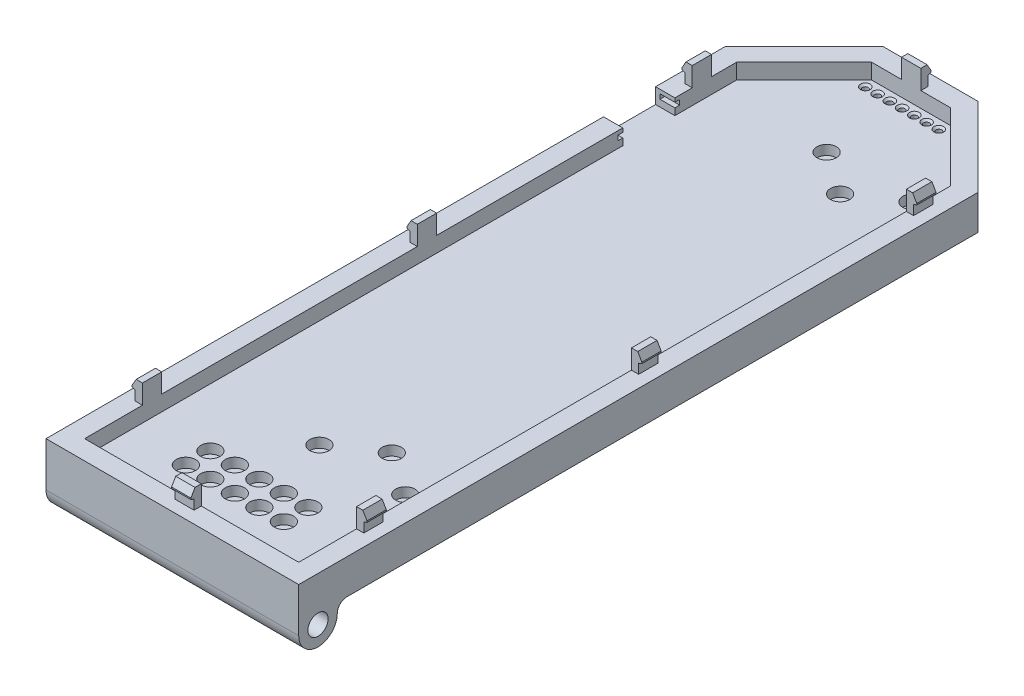
from build123d import *

# Parameters (mm, degrees)
BOSS_EXTRUDE1_DEPTH  = 3.6
CUT_EXTRUDE1_START   = 3.6
CUT_EXTRUDE1_DEPTH   = 1.6
SKETCH3_R            = 0.3
CUT_EXTRUDE2_DEPTH   = 78.737828629
BOSS_EXTRUDE3_DEPTH  = 3
BOSS_EXTRUDE3_TAPER  = 10
SKETCH3_2_R          = 0.3
CUT_EXTRUDE3_DEPTH   = 78.872780874
LPATTERN5_COUNT      = 7
LPATTERN5_PITCH      = 1.27
CHAMFER2_SIZE        = 0.2
FILLET2_R            = 1
BOSS_EXTRUDE4_DEPTH  = 26.2
SKETCH7_R            = 1.05
CUT_EXTRUDE4_DEPTH   = 82.036781772
SKETCH8_W            = 4
SKETCH8_H            = 5.4
CUT_EXTRUDE5_DEPTH   = 1.6
SKETCH9_R            = 1
CUT_EXTRUDE7_DEPTH   = 1
LPATTERN6_COUNT      = 5
LPATTERN6_PITCH      = 2.54
LPATTERN6_COUNT_DIR2 = 2
LPATTERN6_PITCH_DIR2 = 2.54
SKETCH10_R           = 1
CUT_EXTRUDE8_DEPTH   = 1
BOSS_EXTRUDE5_DEPTH  = 1
LPATTERN7_COUNT      = 3
LPATTERN7_PITCH      = 28.5
MIRROR1_COPY_1_DEPTH = 1
MIRROR1_COPY_2_DEPTH = 1
BOSS_EXTRUDE6_DEPTH  = 1
SKETCH14_W           = 6.4
SKETCH14_H           = 0.5
CUT_EXTRUDE9_DEPTH   = 1.55
FILLET3_R            = 1
SKETCH15_R           = 2.794
CUT_EXTRUDE10_DEPTH  = 0.25


with BuildPart() as part:
    # Sketch2 → Boss-Extrude1 (new body)
    with BuildSketch(Plane(origin=(0, 0, 0), x_dir=(1, 0, 0), z_dir=(0, 1, 0))):
        Polygon((0, -2), (-13.1, -2), (-13.1, 68.428427125), (-4.928427125, 76.6), (0, 76.6), (4.928427125, 76.6), (13.1, 68.428427125), (13.1, -2), align=None)
    extrude(amount=BOSS_EXTRUDE1_DEPTH)

    # Sketch1 → Cut-Extrude1 (cut)
    with BuildSketch(Plane(origin=(0, 0, 0), x_dir=(1, 0, 0), z_dir=(0, 1, 0)).offset(CUT_EXTRUDE1_START)):
        Polygon((0, 0), (-11.1, 0), (-11.1, 67.6), (-4.1, 74.6), (0, 74.6), (4.1, 74.6), (11.1, 67.6), (11.1, 0), align=None)
    extrude(amount=-CUT_EXTRUDE1_DEPTH, mode=Mode.SUBTRACT)

    # Sketch3 → Cut-Extrude2 (cut, through all)
    with BuildSketch(Plane(origin=(0, 2, 0), x_dir=(1, 0, 0), z_dir=(0, 1, 0))):
        with Locations(Location((-3.81, 73.66, 0), (0, 0, 270))):
            Circle(SKETCH3_R)
    extrude(amount=-CUT_EXTRUDE2_DEPTH, mode=Mode.SUBTRACT)

    # Sketch5 → Boss-Extrude3 (add)
    with BuildSketch(Plane(origin=(0, 0, 0), x_dir=(-1, 0, 0), z_dir=(0, -1, 0))):
        with BuildLine():
            ThreePointArc((3.81, 72.41), (5.06, 73.66), (3.81, 74.91))
            Line((3.81, 74.91), (-3.782252271, 74.91))
            ThreePointArc((-3.782252271, 74.91), (-5.032252271, 73.66), (-3.782252271, 72.41))
            Line((-3.782252271, 72.41), (3.81, 72.41))
        make_face()
    extrude(amount=BOSS_EXTRUDE3_DEPTH, taper=BOSS_EXTRUDE3_TAPER)

    # Sketch3<2> → Cut-Extrude3 (cut, through all)
    with BuildSketch(Plane(origin=(0, 2, 0), x_dir=(1, 0, 0), z_dir=(0, 1, 0))):
        with Locations(Location((-3.81, 73.66, 0), (0, 0, 270))):
            Circle(SKETCH3_2_R)
    cut_extrude3 = extrude(amount=-CUT_EXTRUDE3_DEPTH, mode=Mode.SUBTRACT)

    # LPattern5: Cut-Extrude3 ×7
    with Locations(*[(i * LPATTERN5_PITCH, 0, 0) for i in range(1, LPATTERN5_COUNT)]):
        add(cut_extrude3, mode=Mode.SUBTRACT)

    # Chamfer2
    chamfer2_edges = [part.edges().sort_by_distance(p)[0] for p in [
        (-3.81, 2, -73.96),
        (-2.54, 2, -73.96),
        (-1.27, 2, -73.96),
        (0, 2, -73.96),
        (1.27, 2, -73.96),
        (2.54, 2, -73.96),
        (3.81, 2, -73.96),
    ]]
    chamfer(chamfer2_edges, length=CHAMFER2_SIZE)

    # Fillet2
    fillet2_edges = [part.edges().sort_by_distance(p)[0] for p in [
        (-5.06, 0, -73.66),
        (-0.013873865, 0, -74.91),
        (5.032252271, 0, -73.66),
        (-0.013873865, 0, -72.41),
    ]]
    fillet(fillet2_edges, radius=FILLET2_R)

    # Sketch6 → Boss-Extrude4 (add)
    with BuildSketch(Plane.ZY.offset(13.1)):
        with BuildLine():
            Line((2, -1), (2, 0))
            Line((2, 0), (-2, 0))
            Line((-2, 0), (-2, -1))
            ThreePointArc((-2, -1), (0, -3), (2, -1))
        make_face()
    extrude(amount=-BOSS_EXTRUDE4_DEPTH)

    # Sketch7 → Cut-Extrude4 (cut, through all)
    with BuildSketch(Plane.ZY.offset(13.1)):
        with Locations((0, -1)):
            Circle(SKETCH7_R)
    extrude(amount=-CUT_EXTRUDE4_DEPTH, mode=Mode.SUBTRACT)

    # Sketch8 → Cut-Extrude5 (cut)
    with BuildSketch(Plane(origin=(0, 3.6, 0), x_dir=(1, 0, 0), z_dir=(0, 1, 0))):
        with Locations((-11.1, 58.5)):
            Rectangle(SKETCH8_W, SKETCH8_H)
    extrude(amount=-CUT_EXTRUDE5_DEPTH, mode=Mode.SUBTRACT)

    # Sketch9 → Cut-Extrude7 (cut)
    with BuildSketch(Plane(origin=(0, 2, 0), x_dir=(1, 0, 0), z_dir=(0, 1, 0))):
        with Locations(Location((-5.08, 4.48, 0), (0, 0, 270))):
            Circle(SKETCH9_R)
    cut_extrude7 = extrude(amount=-CUT_EXTRUDE7_DEPTH, mode=Mode.SUBTRACT)

    # LPattern6: Cut-Extrude7 5 × 2
    with Locations(*[(i * LPATTERN6_PITCH, 0, -j * LPATTERN6_PITCH_DIR2) for i in range(LPATTERN6_COUNT) for j in range(LPATTERN6_COUNT_DIR2) if (i, j) != (0, 0)]):
        add(cut_extrude7, mode=Mode.SUBTRACT)

    # Sketch10 → Cut-Extrude8 (cut)
    with BuildSketch(Plane(origin=(0, 2, 0), x_dir=(1, 0, 0), z_dir=(0, 1, 0))):
        with Locations(Location((0.05, 13.2, 0), (0, 0, 270))):
            Circle(SKETCH10_R)
        with Locations(Location((4.5, 16.25, 0), (0, 0, 270))):
            Circle(SKETCH10_R)
        with Locations(Location((8.95, 13.2, 0), (0, 0, 270))):
            Circle(SKETCH10_R)
        with Locations(Location((8.95, 65.782, 0), (0, 0, 90))):
            Circle(SKETCH10_R)
        with Locations(Location((4.5, 62.732, 0), (0, 0, 90))):
            Circle(SKETCH10_R)
        with Locations(Location((0.05, 65.782, 0), (0, 0, 90))):
            Circle(SKETCH10_R)
    extrude(amount=-CUT_EXTRUDE8_DEPTH, mode=Mode.SUBTRACT)

    # Sketch11 → Boss-Extrude5 (add, symmetric)
    with BuildSketch(Plane.XY.offset(-7)):
        Polygon((-11.1, 3.6), (-11.1, 5.6), (-11.75, 5.6), (-12.18, 4.855218153), (-12.18, 4.720110177), (-11.85, 4.6), (-11.85, 3.6), align=None)
    boss_extrude5 = extrude(amount=BOSS_EXTRUDE5_DEPTH, both=True)

    # LPattern7: Boss-Extrude5 ×3
    with Locations(*[(0, 0, -i * LPATTERN7_PITCH) for i in range(1, LPATTERN7_COUNT)]):
        add(boss_extrude5)

    # Mirror1: Boss-Extrude5 across plane
    add(boss_extrude5.mirror(Plane(origin=(0, 0, 0), x_dir=(0, 0, 1), z_dir=(1, 0, 0))))

    # Mirror1 copy 1 sketch → Mirror1 copy 1 (add, symmetric)
    with BuildSketch(Plane(origin=(0, 0, -35.5), x_dir=(-1, 0, 0), z_dir=(0, 0, 1))):
        Polygon((-11.1, -3.6), (-11.1, -5.6), (-11.75, -5.6), (-12.18, -4.855218153), (-12.18, -4.720110177), (-11.85, -4.6), (-11.85, -3.6), align=None)
    extrude(amount=MIRROR1_COPY_1_DEPTH, both=True)

    # Mirror1 copy 2 sketch → Mirror1 copy 2 (add, symmetric)
    with BuildSketch(Plane(origin=(0, 0, -64), x_dir=(-1, 0, 0), z_dir=(0, 0, 1))):
        Polygon((-11.1, -3.6), (-11.1, -5.6), (-11.75, -5.6), (-12.18, -4.855218153), (-12.18, -4.720110177), (-11.85, -4.6), (-11.85, -3.6), align=None)
    extrude(amount=MIRROR1_COPY_2_DEPTH, both=True)

    # Sketch13 → Boss-Extrude6 (add, symmetric)
    with BuildSketch(Plane(origin=(0, 0, 0), x_dir=(0, 0, -1), z_dir=(1, 0, 0))):
        Polygon((0, 3.6), (0, 5.6), (-0.65, 5.6), (-1.08, 4.855218153), (-1.08, 4.720110177), (-0.75, 4.6), (-0.75, 3.6), align=None)
    boss_extrude6 = extrude(amount=BOSS_EXTRUDE6_DEPTH, both=True)

    # Mirror2: Boss-Extrude6 across plane
    add(boss_extrude6.mirror(Plane.XY.offset(-37.3)))

    # Sketch14 → Cut-Extrude9 (cut)
    with BuildSketch(Plane(origin=(-11.1, 0, 0), x_dir=(0, 0, -1), z_dir=(1, 0, 0))):
        with Locations((58.5, 2.95)):
            Rectangle(SKETCH14_W, SKETCH14_H)
    extrude(amount=-CUT_EXTRUDE9_DEPTH, mode=Mode.SUBTRACT)

    # Fillet3
    fillet3_edges = [part.edges().sort_by_distance(p)[0] for p in [
        (0, 0, -2),
    ]]
    fillet(fillet3_edges, radius=FILLET3_R - 0.0001)  # a hair under: the kernel refuses the full size

    # Sketch15 → Cut-Extrude10 (cut)
    with BuildSketch(Plane.XZ):
        with Locations(Location((0, -10, 0), (0, 0, 270))):
            Circle(SKETCH15_R)
    extrude(amount=-CUT_EXTRUDE10_DEPTH, mode=Mode.SUBTRACT)


solid = part.part
